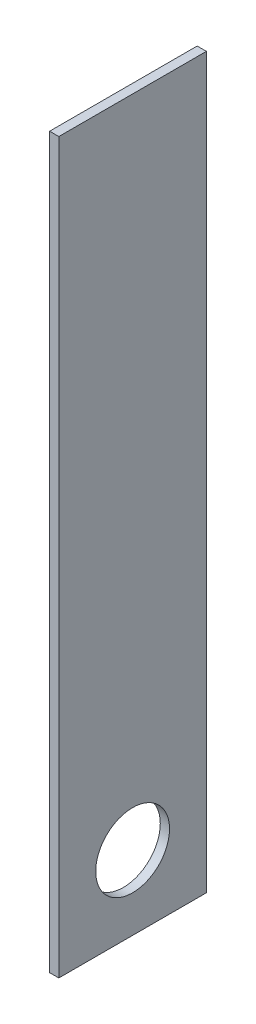
from build123d import *

# Parameters (mm, degrees)
SKETCH1_W           = 50.8
SKETCH1_H           = 250.825
SKETCH1_R           = 12.7
BOSS_EXTRUDE1_DEPTH = 3.175


with BuildPart() as part:
    # Sketch1 → Boss-Extrude1 (new body)
    with BuildSketch(Plane(origin=(0, 0, 0), x_dir=(0, 0, -1), z_dir=(1, 0, 0))):
        Rectangle(SKETCH1_W, SKETCH1_H)
        with Locations((0, -100.0125)):
            Circle(SKETCH1_R, mode=Mode.SUBTRACT)
    extrude(amount=BOSS_EXTRUDE1_DEPTH)


solid = part.part
